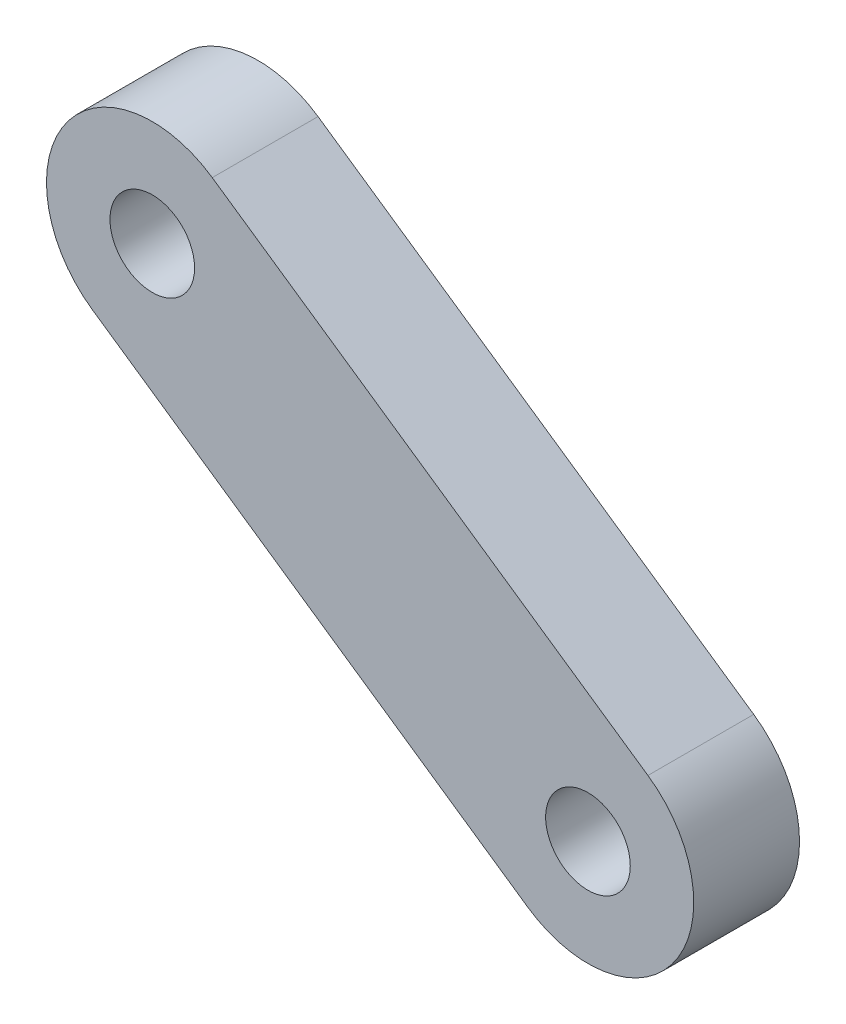
from build123d import *

# Parameters (mm, degrees)
SKETCH1_R           = 2
BOSS_EXTRUDE1_DEPTH = 5


with BuildPart() as part:
    # Sketch1 → Boss-Extrude1 (new body)
    with BuildSketch(Plane(origin=(0, 0, 0), x_dir=(0.9997573026985189, -0.022030335925312537, 0), z_dir=(0, 0, 1))):
        with BuildLine():
            Line((-22.59104637, 74.16019754), (-43.491829272, 87.877240738))
            ThreePointArc((-43.491829272, 87.877240738), (-50.415394492, 86.440492797), (-48.978646551, 79.516927577))
            Line((-48.978646551, 79.516927577), (-28.077863649, 65.799884379))
            ThreePointArc((-28.077863649, 65.799884379), (-21.15429843, 67.23663232), (-22.59104637, 74.16019754))
        make_face()
        with Locations((-25.33445501, 69.980040959)):
            Circle(SKETCH1_R, mode=Mode.SUBTRACT)
        with Locations((-46.235237911, 83.697084158)):
            Circle(SKETCH1_R, mode=Mode.SUBTRACT)
    extrude(amount=BOSS_EXTRUDE1_DEPTH)


solid = part.part
